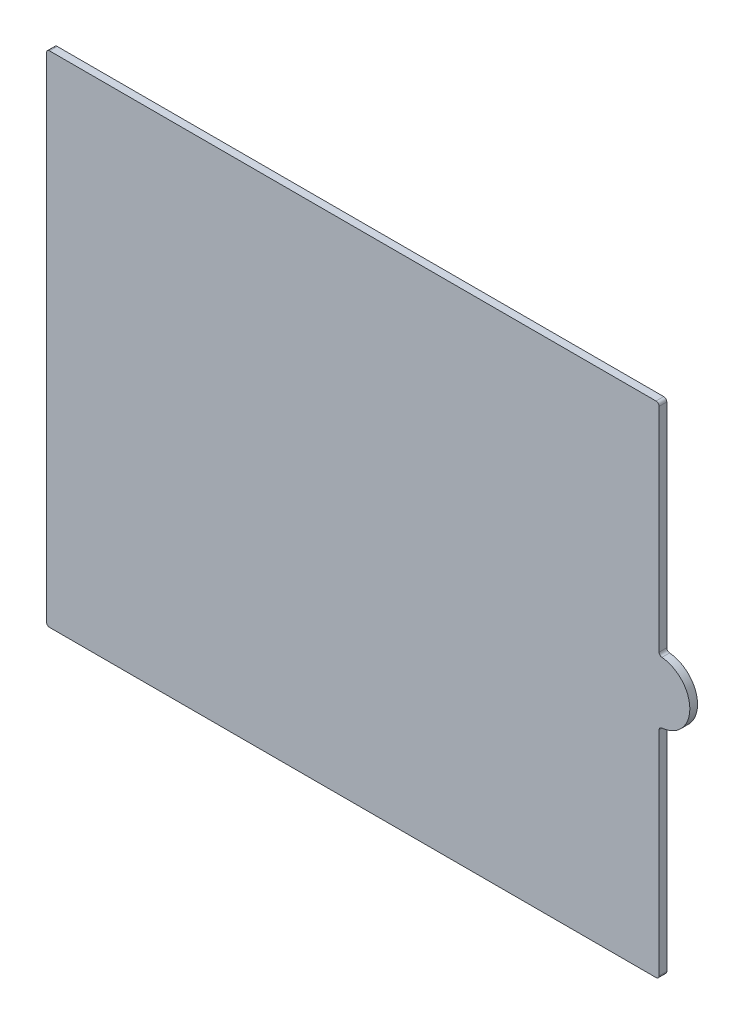
from build123d import *

# Parameters (mm, degrees)
BOSS_EXTRUDE2_DEPTH = 3.175
FILLET1_R           = 1.27


# Read off the part's stored shape, not the designer's step: Boss-Extrude2
with BuildPart() as part:
    # Boss-Extrude2 outline → Boss-Extrude2 (new body)
    with BuildSketch(Plane.XY):
        with BuildLine():
            ThreePointArc((253.1745, 90.4748), (265.8745, 103.1748), (253.1745, 115.8748))
            Line((253.1745, 115.8748), (253.1745, 206.3496))
            Line((253.1745, 206.3496), (0, 206.3496))
            Line((0, 206.3496), (0, 0))
            Line((0, 0), (253.1745, 0))
            Line((253.1745, 0), (253.1745, 90.4748))
        make_face()
    extrude(amount=BOSS_EXTRUDE2_DEPTH)

    # Fillet1
    fillet1_edges = [part.edges().sort_by_distance(p)[0] for p in [
        (253.1745, 90.4748, 1.5875),
        (253.1745, 0, 1.5875),
        (0, 0, 1.5875),
        (0, 206.3496, 1.5875),
        (253.1745, 206.3496, 1.5875),
        (253.1745, 115.8748, 1.5875),
    ]]
    fillet(fillet1_edges, radius=FILLET1_R)


solid = part.part
